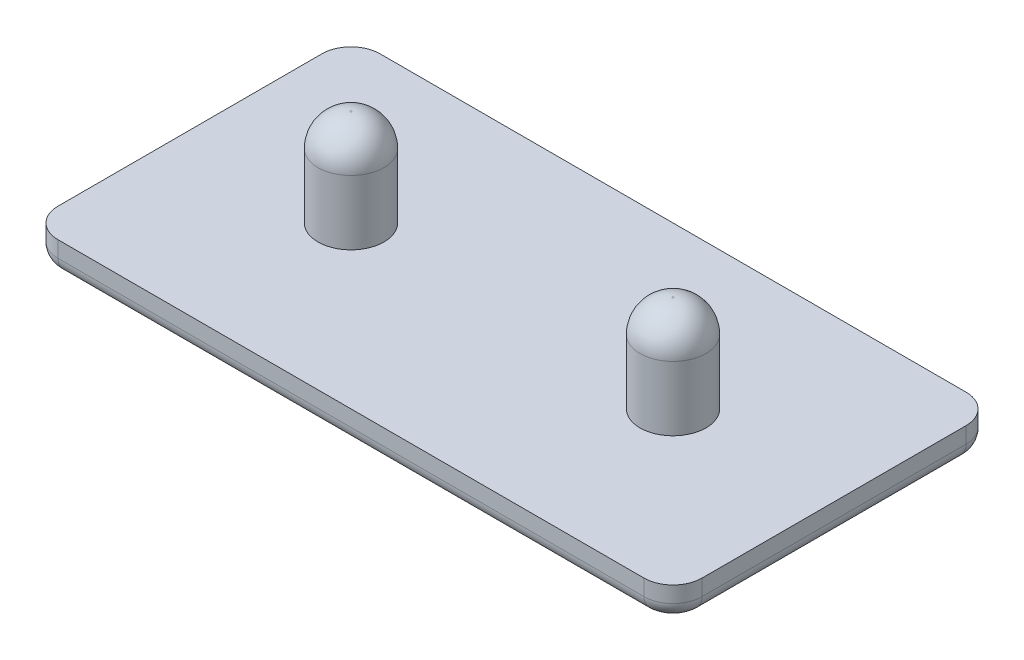
from build123d import *

# Parameters (mm, degrees)
SKETCH1_R           = 2.05
BOSS_EXTRUDE1_DEPTH = 2
SKETCH1_2_R         = 2.05
BOSS_EXTRUDE2_DEPTH = 8
FILLET1_R           = 2
FILLET2_R           = 1


with BuildPart() as part:
    # Sketch1 → Boss-Extrude1 (new body)
    with BuildSketch(Plane(origin=(0, 0, 0), x_dir=(1, 0, 0), z_dir=(0, 1, 0))):
        with BuildLine():
            Line((1.8, 0), (38.2, 0))
            ThreePointArc((38.2, 0), (39.472792206, 0.527207794), (40, 1.8))
            Line((40, 1.8), (40, 18.2))
            ThreePointArc((40, 18.2), (39.472792206, 19.472792206), (38.2, 20))
            Line((38.2, 20), (1.8, 20))
            ThreePointArc((1.8, 20), (0.527207794, 19.472792206), (0, 18.2))
            Line((0, 18.2), (0, 1.8))
            ThreePointArc((0, 1.8), (0.527207794, 0.527207794), (1.8, 0))
        make_face()
        with Locations((10, 10)):
            Circle(SKETCH1_R, mode=Mode.SUBTRACT)
        with Locations((30, 10)):
            Circle(SKETCH1_R, mode=Mode.SUBTRACT)
    extrude(amount=BOSS_EXTRUDE1_DEPTH)

    # Sketch1<2> → Boss-Extrude2 (add)
    with BuildSketch(Plane(origin=(0, 0, 0), x_dir=(1, 0, 0), z_dir=(0, 1, 0))):
        with Locations((30, 10)):
            Circle(SKETCH1_2_R)
        with Locations((10, 10)):
            Circle(SKETCH1_2_R)
    extrude(amount=BOSS_EXTRUDE2_DEPTH)

    # Fillet1
    fillet1_edges = [part.edges().sort_by_distance(p)[0] for p in [
        (7.95, 8, -10),
        (27.95, 8, -10),
    ]]
    fillet(fillet1_edges, radius=FILLET1_R)

    # Fillet2
    fillet2_edges = [part.edges().sort_by_distance(p)[0] for p in [
        (20, 0, 0),
        (39.472792206, 0, -0.527207794),
        (40, 0, -10),
        (39.472792206, 0, -19.472792206),
        (20, 0, -20),
        (0.527207794, 0, -19.472792206),
        (0, 0, -10),
        (0.527207794, 0, -0.527207794),
    ]]
    fillet(fillet2_edges, radius=FILLET2_R)


solid = part.part
